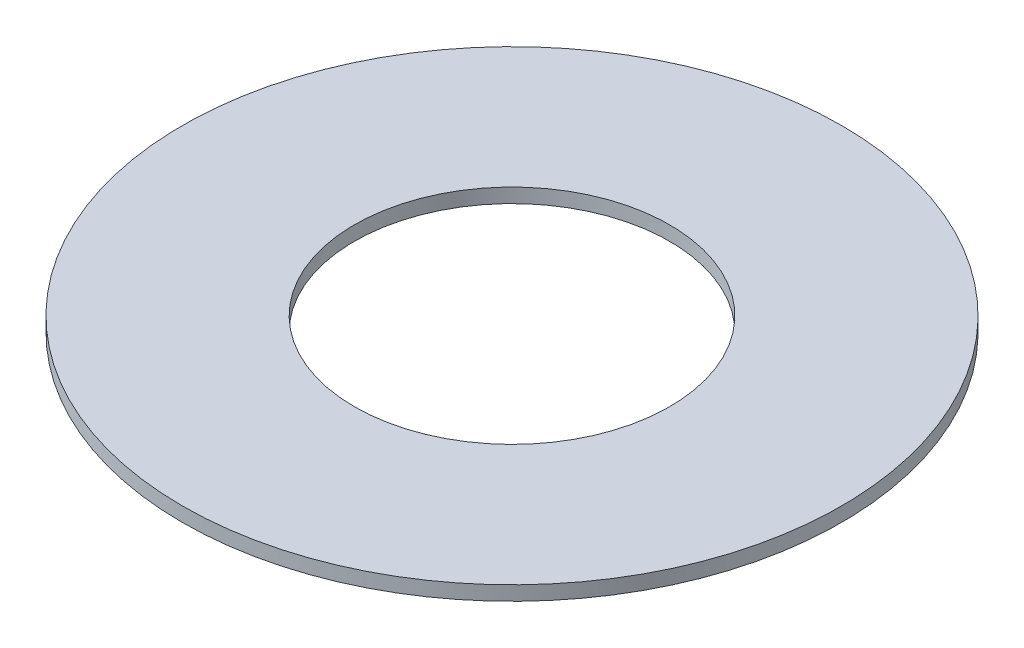
from build123d import *

# Parameters (mm, degrees)
SKETCH1_R           = 46
SKETCH1_R_2         = 22
BOSS_EXTRUDE1_DEPTH = 2


with BuildPart() as part:
    # Sketch1 → Boss-Extrude1 (new body)
    with BuildSketch(Plane(origin=(0, 0, 0), x_dir=(1, 0, 0), z_dir=(0, 1, 0))):
        Circle(SKETCH1_R)
        Circle(SKETCH1_R_2, mode=Mode.SUBTRACT)
    extrude(amount=BOSS_EXTRUDE1_DEPTH)


solid = part.part
